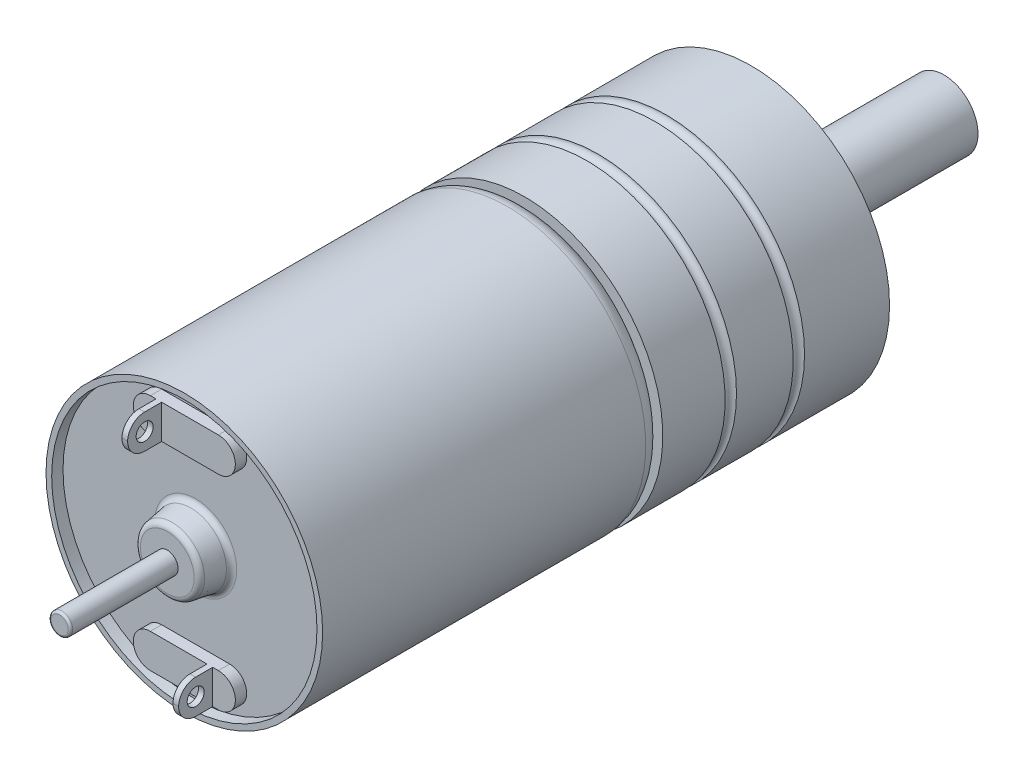
from build123d import *

# Parameters (mm, degrees)
SKETCH_1_R               = 12.2
EXTRUDE_1_DEPTH          = 50
SKETCH_14_R              = 11.7
CUT_EXTRUDE_4_DEPTH      = 1
FILLET_3_R               = 0.5
SKETCH_16_R              = 0.95
EXTRUDE_7_DEPTH          = 9.5
FILLET_4_R               = 0.2
SKETCH_4_R               = 4.5
EXTRUDE_3_DEPTH          = 2.5
SKETCH_5_R               = 3
EXTRUDE_4_DEPTH          = 14.5
CUT_EXTRUDE_START        = -12
CUT_EXTRUDE_1_DEPTH      = 12
SKETCH_8_R               = 1.25
CUT_EXTRUDE_2_DEPTH      = 4
EXTRUDE_5_DEPTH          = 1
SKETCH_12_W              = 0.5
SKETCH_12_H              = 3
EXTRUDE_6_DEPTH          = 3
FILLET_2_R               = 1.5
CUT_EXTRUDE_3_DEPTH      = 64.80814995
CUT_EXTRUDE_3_DEPTH_BACK = 64.80814995
SKETCH_13_R              = 0.75
SKETCH_17_R              = 0.5


with BuildPart() as part:
    # 草图1 → 凸台-拉伸1 (new body)
    with BuildSketch(Plane.XY):
        Circle(SKETCH_1_R)
    extrude(amount=EXTRUDE_1_DEPTH)

    # 草图14 → 切除-拉伸4 (cut)
    with BuildSketch(Plane.XY.offset(50)):
        Circle(SKETCH_14_R)
    extrude(amount=-CUT_EXTRUDE_4_DEPTH, mode=Mode.SUBTRACT)

    # 草图15 → 旋转1 (revolve)
    with BuildSketch(Plane(origin=(0, 0, 0), x_dir=(1, 0, 0), z_dir=(0, 1, 0))):
        Polygon((0, -49), (0, -51.5), (-2.8, -51.5), (-3.2, -49), align=None)
    revolve(axis=Axis((0, 0, 49), (0, 0, 1)))

    # 圆角3
    fillet_3_edges = [part.edges().sort_by_distance(p)[0] for p in [
        (3.2, 0, 49),
        (2.8, 0, 51.5),
    ]]
    fillet(fillet_3_edges, radius=FILLET_3_R)

    # 草图16 → 凸台-拉伸7 (add)
    with BuildSketch(Plane.XY.offset(51.5)):
        Circle(SKETCH_16_R)
    extrude(amount=EXTRUDE_7_DEPTH)

    # 圆角4
    fillet_4_edges = [part.edges().sort_by_distance(p)[0] for p in [
        (-0.95, 0, 61),
    ]]
    fillet(fillet_4_edges, radius=FILLET_4_R)

    # 草图4 → 凸台-拉伸3 (add)
    with BuildSketch(Plane(origin=(0, 0, 0), x_dir=(-1, 0, 0), z_dir=(0, 0, -1))):
        Circle(SKETCH_4_R)
    extrude(amount=EXTRUDE_3_DEPTH)

    # 草图5 → 凸台-拉伸4 (add)
    with BuildSketch(Plane(origin=(0, 0, -2.5), x_dir=(-1, 0, 0), z_dir=(0, 0, -1))):
        with Locations(Location((0, 0, 0), (0, 0, 180))):
            Circle(SKETCH_5_R)
    extrude(amount=EXTRUDE_4_DEPTH)

    # 草图7 → 切除-拉伸1 (cut)
    with BuildSketch(Plane(origin=(0, 0, -17), x_dir=(-1, 0, 0), z_dir=(0, 0, -1)).offset(CUT_EXTRUDE_START)):
        with BuildLine():
            Line((1.658312395, -2.5), (-1.658312395, -2.5))
            ThreePointArc((-1.658312395, -2.5), (0, -3), (1.658312395, -2.5))
        make_face()
    extrude(amount=CUT_EXTRUDE_1_DEPTH, mode=Mode.SUBTRACT)

    # 草图8 → 切除-拉伸2 (cut)
    with BuildSketch(Plane(origin=(0, 0, 0), x_dir=(-1, 0, 0), z_dir=(0, 0, -1))):
        with Locations((0, 9.5)):
            Circle(SKETCH_8_R)
        with Locations((9.5, 0)):
            Circle(SKETCH_8_R)
        with Locations((0, -9.5)):
            Circle(SKETCH_8_R)
        with Locations((-9.5, 0)):
            Circle(SKETCH_8_R)
    extrude(amount=-CUT_EXTRUDE_2_DEPTH, mode=Mode.SUBTRACT)

    # 草图11 → 凸台-拉伸5 (add)
    with BuildSketch(Plane.XY.offset(49)):
        with BuildLine():
            Line((-3, 10.5), (3, 10.5))
            ThreePointArc((3, 10.5), (4.5, 9), (3, 7.5))
            Line((3, 7.5), (-3, 7.5))
            ThreePointArc((-3, 7.5), (-4.5, 9), (-3, 10.5))
        make_face()
        with BuildLine():
            Line((-3, -10.5), (3, -10.5))
            ThreePointArc((3, -10.5), (4.5, -9), (3, -7.5))
            Line((3, -7.5), (-3, -7.5))
            ThreePointArc((-3, -7.5), (-4.5, -9), (-3, -10.5))
        make_face()
    extrude(amount=EXTRUDE_5_DEPTH)

    # 草图12 → 凸台-拉伸6 (add)
    with BuildSketch(Plane.XY.offset(50)):
        with Locations((-2.25, 9)):
            Rectangle(SKETCH_12_W, SKETCH_12_H)
        with Locations((2.25, -9)):
            Rectangle(SKETCH_12_W, SKETCH_12_H)
    extrude(amount=EXTRUDE_6_DEPTH)

    # 圆角2
    fillet_2_edges = [part.edges().sort_by_distance(p)[0] for p in [
        (-2.25, 7.5, 53),
        (-2.25, 10.5, 53),
        (2.25, -10.5, 53),
        (2.25, -7.5, 53),
    ]]
    fillet(fillet_2_edges, radius=FILLET_2_R - 0.0001)  # a hair under: the kernel refuses the full size

    # 草图13 → 切除-拉伸3 (cut, two sides: drawn at the far end of the back side and taken through both)
    with BuildSketch(Plane(origin=(-2, 0, 0), x_dir=(0, 0, -1), z_dir=(1, 0, 0)).offset(-CUT_EXTRUDE_3_DEPTH_BACK)):
        with Locations(Location((-51.5, 9, 0), (0, 0, 90))):
            Circle(SKETCH_13_R)
        with Locations(Location((-51.5, -9, 0), (0, 0, 90))):
            Circle(SKETCH_13_R)
    extrude(amount=CUT_EXTRUDE_3_DEPTH + CUT_EXTRUDE_3_DEPTH_BACK, mode=Mode.SUBTRACT)

    # 草图17 → 切除-旋转1 (revolve, cut)
    with BuildSketch(Plane(origin=(0, 0, 0), x_dir=(1, 0, 0), z_dir=(0, 1, 0))):
        with Locations((-12.2, -8)):
            Circle(SKETCH_17_R)
        with Locations((-12.2, -14)):
            Circle(SKETCH_17_R)
        with BuildLine():
            Line((-10.7, -20), (-12.2, -20))
            Line((-12.2, -20), (-12.2, -21.5))
            ThreePointArc((-12.2, -21.5), (-11.760660172, -20.439339828), (-10.7, -20))
        make_face()
    revolve(axis=Axis((0, 0, 0), (0, 0, 1)), mode=Mode.SUBTRACT)


solid = part.part
